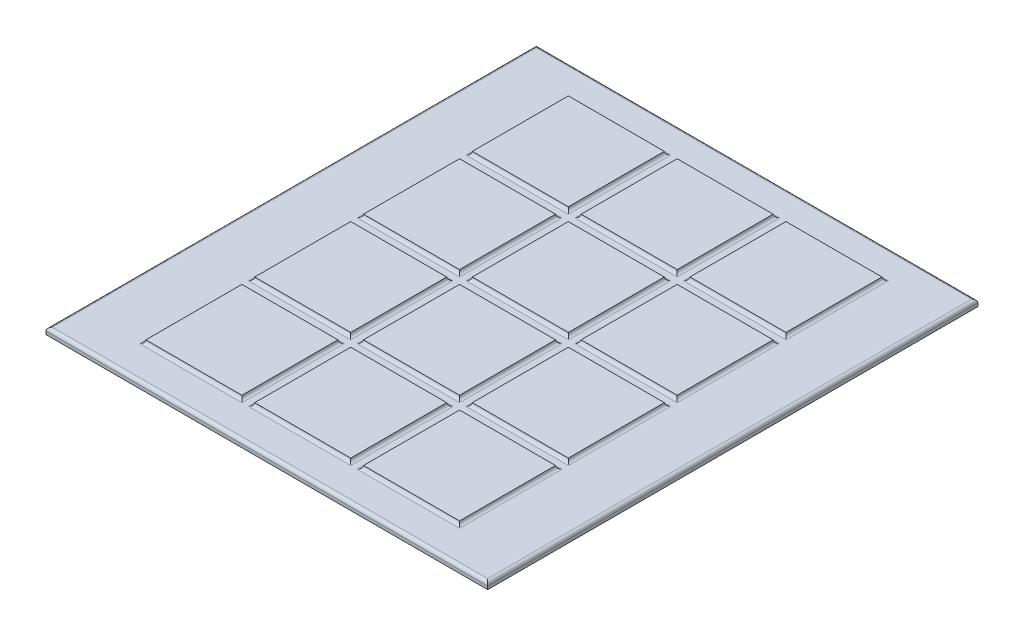
from build123d import *

# Parameters (mm, degrees)
SKETCH1_W           = 69
SKETCH1_H           = 76.6
BOSS_EXTRUDE1_DEPTH = 1
SKETCH2_W           = 15
SKETCH2_H           = 15
BOSS_EXTRUDE2_DEPTH = 0.5
FILLET1_R           = 0.5


with BuildPart() as part:
    # Sketch1 → Boss-Extrude1 (new body)
    with BuildSketch(Plane(origin=(0, 0, 0), x_dir=(1, 0, 0), z_dir=(0, 1, 0))):
        Rectangle(SKETCH1_W, SKETCH1_H)
    extrude(amount=BOSS_EXTRUDE1_DEPTH)

    # Sketch2 → Boss-Extrude2 (add)
    with BuildSketch(Plane(origin=(0, 1, 0), x_dir=(1, 0, 0), z_dir=(0, 1, 0))):
        with Locations((-17, 8.8)):
            Rectangle(SKETCH2_W, SKETCH2_H)
        with Locations((-17, 25.8)):
            Rectangle(SKETCH2_W, SKETCH2_H)
        with Locations((0, 25.8)):
            Rectangle(SKETCH2_W, SKETCH2_H)
        with Locations((17, 25.8)):
            Rectangle(SKETCH2_W, SKETCH2_H)
        with Locations((0, 8.8)):
            Rectangle(SKETCH2_W, SKETCH2_H)
        with Locations((17, 8.8)):
            Rectangle(SKETCH2_W, SKETCH2_H)
        with Locations((-17, -8.2)):
            Rectangle(SKETCH2_W, SKETCH2_H)
        with Locations((0, -8.2)):
            Rectangle(SKETCH2_W, SKETCH2_H)
        with Locations((17, -8.2)):
            Rectangle(SKETCH2_W, SKETCH2_H)
        with Locations((-17, -25.2)):
            Rectangle(SKETCH2_W, SKETCH2_H)
        with Locations((0, -25.2)):
            Rectangle(SKETCH2_W, SKETCH2_H)
        with Locations((17, -25.2)):
            Rectangle(SKETCH2_W, SKETCH2_H)
    extrude(amount=BOSS_EXTRUDE2_DEPTH)

    # Fillet1
    fillet1_edges = [part.edges().sort_by_distance(p)[0] for p in [
        (17, 1, 32.7),
        (24.5, 1, 25.2),
        (17, 1, 17.7),
        (9.5, 1, 25.2),
        (-17, 1, 32.7),
        (-9.5, 1, 25.2),
        (-17, 1, 17.7),
        (-24.5, 1, 25.2),
        (0, 1, 15.7),
        (7.5, 1, 8.2),
        (0, 1, 0.7),
        (-7.5, 1, 8.2),
        (17, 1, -1.3),
        (24.5, 1, -8.8),
        (17, 1, -16.3),
        (9.5, 1, -8.8),
        (-17, 1, -1.3),
        (-9.5, 1, -8.8),
        (-17, 1, -16.3),
        (-24.5, 1, -8.8),
        (0, 1, -18.3),
        (7.5, 1, -25.8),
        (0, 1, -33.3),
        (-7.5, 1, -25.8),
        (34.5, 1, 0),
        (0, 1, 38.3),
        (-34.5, 1, 0),
        (0, 1, -38.3),
        (-17, 1, -18.3),
        (-9.5, 1, -25.8),
        (-17, 1, -33.3),
        (-24.5, 1, -25.8),
        (17, 1, -18.3),
        (24.5, 1, -25.8),
        (17, 1, -33.3),
        (9.5, 1, -25.8),
        (0, 1, -1.3),
        (7.5, 1, -8.8),
        (0, 1, -16.3),
        (-7.5, 1, -8.8),
        (-17, 1, 15.7),
        (-9.5, 1, 8.2),
        (-17, 1, 0.7),
        (-24.5, 1, 8.2),
        (17, 1, 15.7),
        (24.5, 1, 8.2),
        (17, 1, 0.7),
        (9.5, 1, 8.2),
        (0, 1, 32.7),
        (7.5, 1, 25.2),
        (0, 1, 17.7),
        (-7.5, 1, 25.2),
    ]]
    fillet(fillet1_edges, radius=FILLET1_R - 0.0001)  # a hair under: the kernel refuses the full size


solid = part.part
